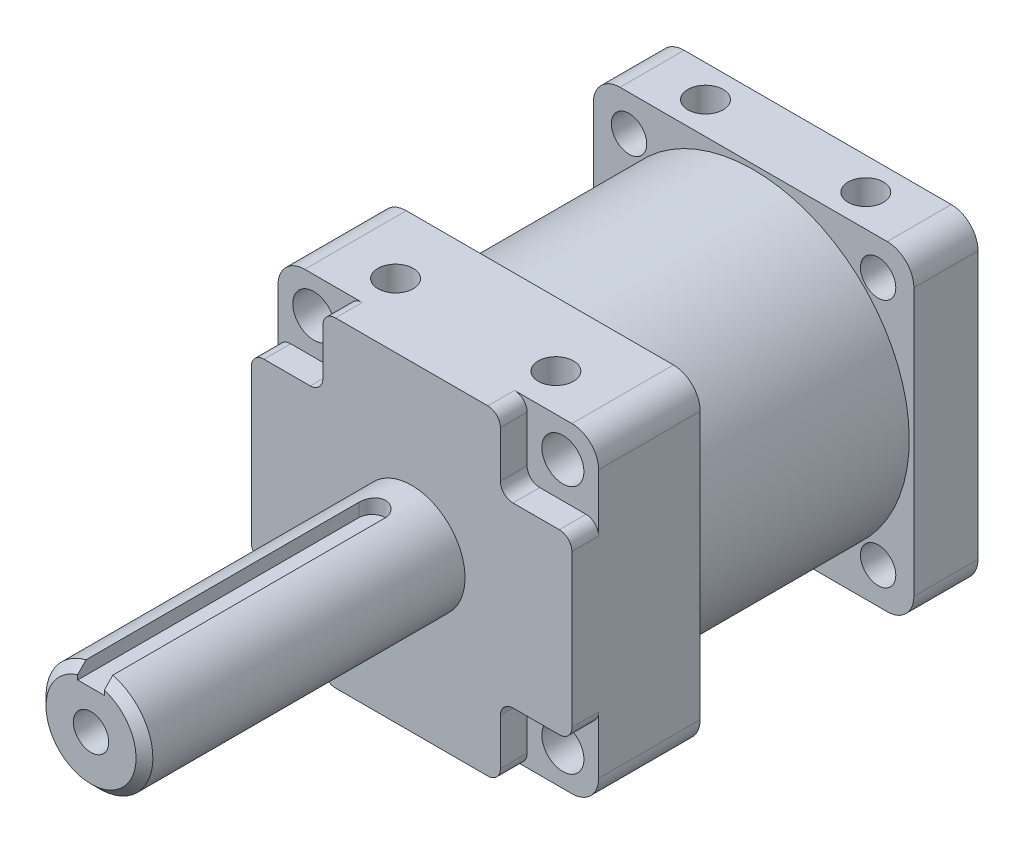
from build123d import *

# Parameters (mm, degrees)
SKETCH1_W                      = 38.1
SKETCH1_H                      = 38.1
EXTRUDE1_DEPTH                 = 15.24
FILLET1_R                      = 3.175
SKETCH2_R                      = 6.35
EXTRUDE2_DEPTH                 = 38.1
CHAMFER1_SIZE                  = 1
SKETCH3_W                      = 3.175
SKETCH3_H                      = 3.175
EXTRUDE3_DEPTH                 = 35
FILLET2_R                      = 1.5875
M5X0_8_TAPPED_HOLE1_D          = 4.2
M5X0_8_TAPPED_HOLE1_DEPTH      = 14
M5X0_8_TAPPED_HOLE1_TIP        = 1.2618073
SKETCH7_R                      = 18.5
EXTRUDE4_DEPTH                 = 25.4
EXTRUDE5_DEPTH                 = 7.62
SKETCH9_W                      = 8.5
SKETCH9_H                      = 8.5
EXTRUDE7_DEPTH                 = 3.175
FILLET3_R                      = 1.5
SKETCH10_R                     = 2.5
EXTRUDE8_DEPTH                 = 12.065
M5X0_8_TAPPED_HOLE2_D          = 4.2
M5X0_8_TAPPED_HOLE3_AT_2_COUNT = 2
M5X0_8_TAPPED_HOLE3_AT_2_PITCH = 19.05
M5X0_8_TAPPED_HOLE3_AT_3_COUNT = 2
M5X0_8_TAPPED_HOLE3_AT_3_PITCH = 36.83
M5X0_8_TAPPED_HOLE3_AT_4_COUNT = 2
M5X0_8_TAPPED_HOLE3_AT_4_PITCH = 41.465062402


with BuildPart() as part:
    # Sketch1 → Extrude1 (new body)
    with BuildSketch(Plane.XY):
        Rectangle(SKETCH1_W, SKETCH1_H)
    extrude(amount=EXTRUDE1_DEPTH)

    # Fillet1
    fillet1_edges = [part.edges().sort_by_distance(p)[0] for p in [
        (19.05, -19.05, 7.62),
        (-19.05, -19.05, 7.62),
        (-19.05, 19.05, 7.62),
        (19.05, 19.05, 7.62),
    ]]
    fillet(fillet1_edges, radius=FILLET1_R)

    # Sketch2 → Extrude2 (add)
    with BuildSketch(Plane.XY.offset(15.24)):
        with Locations(Location((0, 0, 0), (0, 0, 180))):
            Circle(SKETCH2_R)
    extrude(amount=EXTRUDE2_DEPTH)

    # Chamfer1
    chamfer1_edges = [part.edges().sort_by_distance(p)[0] for p in [
        (6.35, 0, 53.34),
    ]]
    chamfer(chamfer1_edges, length=CHAMFER1_SIZE)

    # Sketch3 → Extrude3 (cut)
    with BuildSketch(Plane.XY.offset(53.34)):
        with Locations((0, 6.148361062)):
            Rectangle(SKETCH3_W, SKETCH3_H)
    extrude(amount=-EXTRUDE3_DEPTH, mode=Mode.SUBTRACT)

    # Fillet2
    fillet2_edges = [part.edges().sort_by_distance(p)[0] for p in [
        (1.5875, 5.354611062, 18.34),
        (-1.5875, 5.354611062, 18.34),
    ]]
    fillet(fillet2_edges, radius=FILLET2_R - 0.0001)  # a hair under: the kernel refuses the full size

    # M5x0.8 Tapped Hole1
    with Locations(Plane.XY.offset(53.34)):
        with Locations((0, 0)):
            Hole(M5X0_8_TAPPED_HOLE1_D / 2, depth=M5X0_8_TAPPED_HOLE1_DEPTH)
            with Locations((0, 0, -(M5X0_8_TAPPED_HOLE1_DEPTH + M5X0_8_TAPPED_HOLE1_TIP / 2))):  # 118° drill point
                Cone(0, M5X0_8_TAPPED_HOLE1_D / 2, M5X0_8_TAPPED_HOLE1_TIP, mode=Mode.SUBTRACT)

    # Sketch7 → Extrude4 (add)
    with BuildSketch(Plane(origin=(0, 0, 0), x_dir=(-1, 0, 0), z_dir=(0, 0, -1))):
        Circle(SKETCH7_R)
    extrude(amount=EXTRUDE4_DEPTH)

    # Sketch8 → Extrude5 (add)
    with BuildSketch(Plane(origin=(0, 0, -25.4), x_dir=(-1, 0, 0), z_dir=(0, 0, -1))):
        with BuildLine():
            Line((-15.875, -19.05), (15.875, -19.05))
            ThreePointArc((15.875, -19.05), (18.12006403, -18.12006403), (19.05, -15.875))
            Line((19.05, -15.875), (19.05, 15.875))
            ThreePointArc((19.05, 15.875), (18.12006403, 18.12006403), (15.875, 19.05))
            Line((15.875, 19.05), (-15.875, 19.05))
            ThreePointArc((-15.875, 19.05), (-18.12006403, 18.12006403), (-19.05, 15.875))
            Line((-19.05, 15.875), (-19.05, -15.875))
            ThreePointArc((-19.05, -15.875), (-18.12006403, -18.12006403), (-15.875, -19.05))
        make_face()
    extrude(amount=EXTRUDE5_DEPTH)

    # Sketch9 → Extrude7 (cut)
    with BuildSketch(Plane.XY.offset(15.24)):
        with Locations((-14.8, 14.8)):
            Rectangle(SKETCH9_W, SKETCH9_H)
        with Locations((14.8, 14.8)):
            Rectangle(SKETCH9_W, SKETCH9_H)
        with Locations((14.8, -14.8)):
            Rectangle(SKETCH9_W, SKETCH9_H)
        with Locations((-14.8, -14.8)):
            Rectangle(SKETCH9_W, SKETCH9_H)
    extrude(amount=-EXTRUDE7_DEPTH, mode=Mode.SUBTRACT)

    # Fillet3
    fillet3_edges = [part.edges().sort_by_distance(p)[0] for p in [
        (-19.05, 10.55, 13.6525),
        (-10.55, 19.05, 13.6525),
        (-10.55, 10.55, 13.6525),
        (10.55, 19.05, 13.6525),
        (19.05, 10.55, 13.6525),
        (10.55, 10.55, 13.6525),
        (19.05, -10.55, 13.6525),
        (10.55, -19.05, 13.6525),
        (10.55, -10.55, 13.6525),
        (-10.55, -19.05, 13.6525),
        (-19.05, -10.55, 13.6525),
        (-10.55, -10.55, 13.6525),
    ]]
    fillet(fillet3_edges, radius=FILLET3_R)

    # Sketch10 → Extrude8 (cut)
    with BuildSketch(Plane.XY.offset(12.065)):
        with Locations((-14.8, 14.8)):
            Circle(SKETCH10_R)
        with Locations(Location((-14.8, -14.8, 0), (0, 0, 32.271518342))):
            Circle(SKETCH10_R)
        with Locations((14.8, -14.8)):
            Circle(SKETCH10_R)
        with Locations(Location((14.8, 14.8, 0), (0, 0, 237.728481658))):
            Circle(SKETCH10_R)
    extrude(amount=-EXTRUDE8_DEPTH, mode=Mode.SUBTRACT)

    # M5x0.8 Tapped Hole2 (through all)
    with Locations(Plane.XY.offset(-25.4)):
        with Locations((-14.8, 14.8), (14.8, 14.8), (14.8, -14.8), (-14.8, -14.8)):
            Hole(M5X0_8_TAPPED_HOLE2_D / 2)

    # Sketch13 → M5x0.8 Tapped Hole3 (revolve, cut)
    with BuildSketch(Plane(origin=(-9.525, 19.05, -29.21), x_dir=(0, 0, 1), z_dir=(1, 0, 0))):
        Polygon((0, 0), (0, 8.8818073), (2.1, 7.62), (2.1, 0), align=None)
    m5x0_8_tapped_hole3 = revolve(axis=Axis((-9.525, 25.4, -29.21), (0, -1, 0)), mode=Mode.SUBTRACT)

    # M5x0.8 Tapped Hole3 at 2: M5x0.8 Tapped Hole3 ×2
    with Locations(*[(i * M5X0_8_TAPPED_HOLE3_AT_2_PITCH, 0, 0) for i in range(1, M5X0_8_TAPPED_HOLE3_AT_2_COUNT)]):
        add(m5x0_8_tapped_hole3, mode=Mode.SUBTRACT)

    # M5x0.8 Tapped Hole3 at 3: M5x0.8 Tapped Hole3 ×2
    with Locations(*[(0, 0, i * M5X0_8_TAPPED_HOLE3_AT_3_PITCH) for i in range(1, M5X0_8_TAPPED_HOLE3_AT_3_COUNT)]):
        add(m5x0_8_tapped_hole3, mode=Mode.SUBTRACT)

    # M5x0.8 Tapped Hole3 at 4: M5x0.8 Tapped Hole3 ×2
    with Locations(*[Vector(0.4594229188737666, 0, 0.8882176431559489) * (i * M5X0_8_TAPPED_HOLE3_AT_4_PITCH) for i in range(1, M5X0_8_TAPPED_HOLE3_AT_4_COUNT)]):
        add(m5x0_8_tapped_hole3, mode=Mode.SUBTRACT)

    # Mirror2: M5x0.8 Tapped Hole3 across plane
    add(m5x0_8_tapped_hole3.mirror(Plane.ZX), mode=Mode.SUBTRACT)

    # Mirror2 copy 1 sketch → Mirror2 copy 1 (revolve, cut)
    with BuildSketch(Plane(origin=(9.525, -19.05, -29.21), x_dir=(0, 0, 1), z_dir=(1, 0, 0))):
        Polygon((0, 0), (0, -8.8818073), (2.1, -7.62), (2.1, 0), align=None)
    revolve(axis=Axis((9.525, -25.4, -29.21), (0, -1, 0)), mode=Mode.SUBTRACT)

    # Mirror2 copy 2 sketch → Mirror2 copy 2 (revolve, cut)
    with BuildSketch(Plane(origin=(-9.525, -19.05, 7.62), x_dir=(0, 0, 1), z_dir=(1, 0, 0))):
        Polygon((0, 0), (0, -8.8818073), (2.1, -7.62), (2.1, 0), align=None)
    revolve(axis=Axis((-9.525, -25.4, 7.62), (0, -1, 0)), mode=Mode.SUBTRACT)

    # Mirror2 copy 3 sketch → Mirror2 copy 3 (revolve, cut)
    with BuildSketch(Plane(origin=(9.525, -19.05, 7.62), x_dir=(0, 0, 1), z_dir=(1, 0, 0))):
        Polygon((0, 0), (0, -8.8818073), (2.1, -7.62), (2.1, 0), align=None)
    revolve(axis=Axis((9.525, -25.4, 7.62), (0, -1, 0)), mode=Mode.SUBTRACT)


solid = part.part
